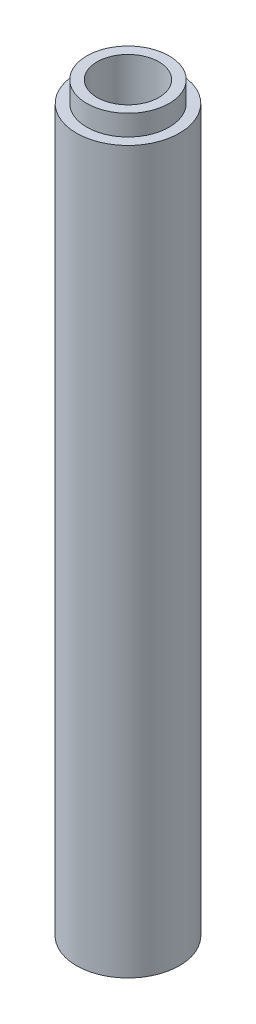
from build123d import *

# Parameters (mm, degrees)
SKETCH1_R           = 12.7
BOSS_EXTRUDE1_DEPTH = 177.8
SKETCH4_R           = 10.16
BOSS_EXTRUDE2_DEPTH = 5.08
SKETCH5_R           = 7.62
CUT_EXTRUDE1_DEPTH  = 184.759828036


with BuildPart() as part:
    # Sketch1 → Boss-Extrude1 (new body)
    with BuildSketch(Plane(origin=(0, 0, 0), x_dir=(1, 0, 0), z_dir=(0, 1, 0))):
        Circle(SKETCH1_R)
    extrude(amount=BOSS_EXTRUDE1_DEPTH)

    # Sketch4 → Boss-Extrude2 (add)
    with BuildSketch(Plane(origin=(0, 177.8, 0), x_dir=(1, 0, 0), z_dir=(0, 1, 0))):
        Circle(SKETCH4_R)
    extrude(amount=BOSS_EXTRUDE2_DEPTH)

    # Sketch5 → Cut-Extrude1 (cut, through all)
    with BuildSketch(Plane(origin=(0, 182.88, 0), x_dir=(1, 0, 0), z_dir=(0, 1, 0))):
        Circle(SKETCH5_R)
    extrude(amount=-CUT_EXTRUDE1_DEPTH, mode=Mode.SUBTRACT)


solid = part.part
